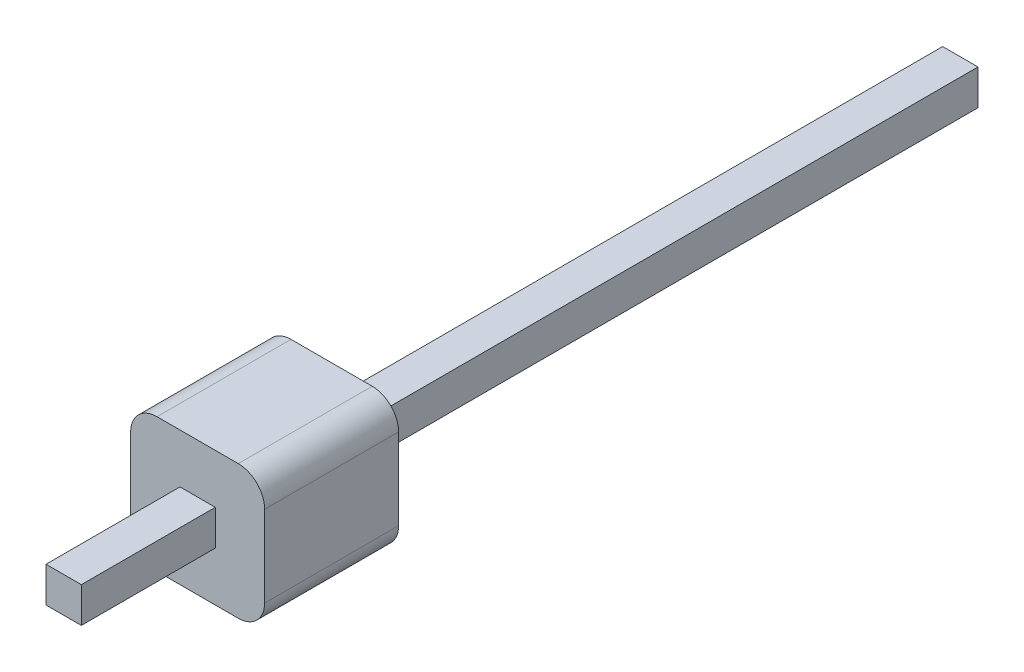
from build123d import *

# Parameters (mm, degrees)
SKETCH_1_W      = 2.54
SKETCH_1_H      = 2.54
EXTRUDE_1_DEPTH = 2.54
SKETCH_2_W      = 0.67
SKETCH_2_H      = 0.67
FILLET_1_R      = 0.5


with BuildPart() as part:
    # 草图1 → 拉伸1 (new body)
    with BuildSketch(Plane.XY):
        Rectangle(SKETCH_1_W, SKETCH_1_H)
    extrude(amount=EXTRUDE_1_DEPTH)

    # 扫描1: sweep along a path in 草图3
    with BuildLine(Plane(origin=(0, 0, 0), x_dir=(0, 0, -1), z_dir=(1, 0, 0))) as sweep_1_path:
        Line((11.92, -0.01), (-5.08, -0.01))
    # 草图2 → 扫描1 (sweep)
    with BuildSketch(Plane(origin=(0, 0, 5.08), x_dir=(-1, 0, 0), z_dir=(0, 0, -1))):
        Rectangle(SKETCH_2_W, SKETCH_2_H)
    sweep(path=sweep_1_path.line)

    # 圆角1
    fillet_1_edges = [part.edges().sort_by_distance(p)[0] for p in [
        (1.27, 1.27, 1.27),
        (1.27, -1.27, 1.27),
        (-1.27, -1.27, 1.27),
        (-1.27, 1.27, 1.27),
    ]]
    fillet(fillet_1_edges, radius=FILLET_1_R)


solid = part.part
